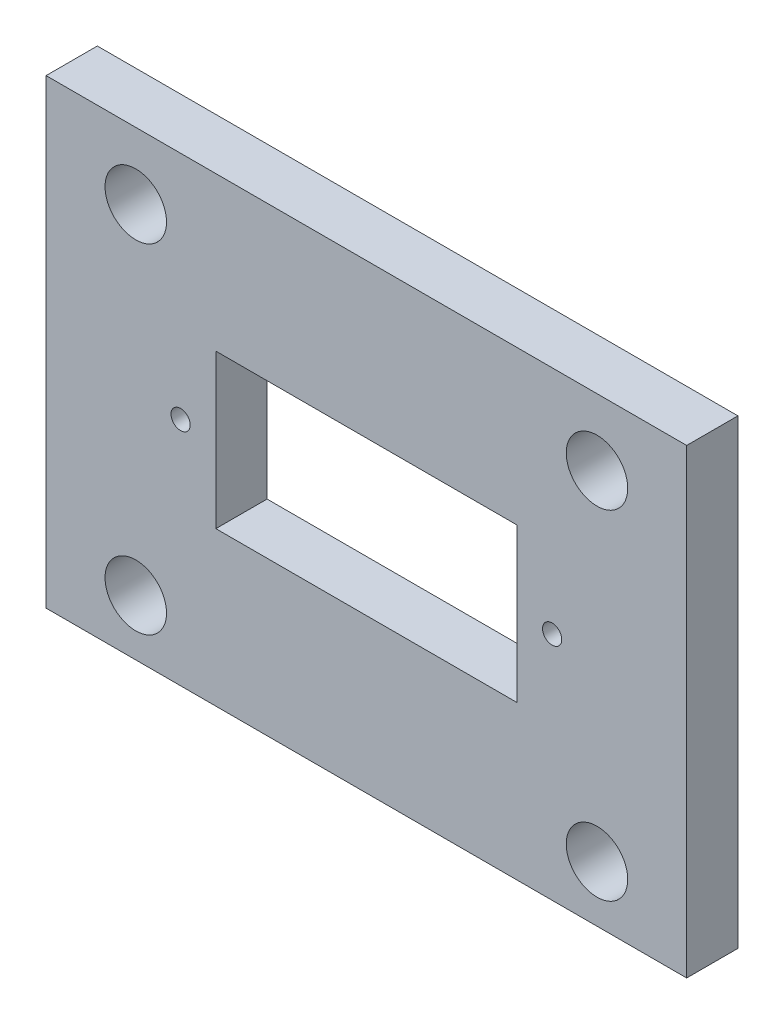
from build123d import *

# Parameters (mm, degrees)
SKETCH1_W           = 50
SKETCH1_H           = 36
SKETCH1_R           = 2.4
BOSS_EXTRUDE1_DEPTH = 4
CUT_EXTRUDE1_REACH  = 50.107
SKETCH2_R           = 0.75


with BuildPart() as part:
    # Sketch1 → Boss-Extrude1 (new body)
    with BuildSketch(Plane.XY):
        with Locations((-16.5, 6)):
            Rectangle(SKETCH1_W, SKETCH1_H)
        with Locations((-34.5, -7.636435185)):
            Circle(SKETCH1_R, mode=Mode.SUBTRACT)
        with Locations((1.5, -7.636435185)):
            Circle(SKETCH1_R, mode=Mode.SUBTRACT)
        Polygon((-28.25, 12), (-16.5, 12), (-4.75, 12), (-4.75, 0), (-16.5, 0), (-28.25, 0), align=None, mode=Mode.SUBTRACT)
        with Locations((-34.5, 18.79673301)):
            Circle(SKETCH1_R, mode=Mode.SUBTRACT)
        with Locations((1.5, 18.79673301)):
            Circle(SKETCH1_R, mode=Mode.SUBTRACT)
    extrude(amount=BOSS_EXTRUDE1_DEPTH)

    # Sketch2 → Cut-Extrude1 (cut, up to next)
    with BuildSketch(Plane.XY.offset(4), mode=Mode.PRIVATE) as cut_extrude1_sk1:
        with Locations((-31, 6)):
            Circle(SKETCH2_R)
    cut_extrude1_tool1 = extrude(cut_extrude1_sk1.sketch, amount=-CUT_EXTRUDE1_REACH, mode=Mode.PRIVATE) & part.part
    # Sketch2 → Cut-Extrude1 (cut, up to next)
    with BuildSketch(Plane.XY.offset(4), mode=Mode.PRIVATE) as cut_extrude1_sk2:
        with Locations((-2, 6)):
            Circle(SKETCH2_R)
    cut_extrude1_tool2 = extrude(cut_extrude1_sk2.sketch, amount=-CUT_EXTRUDE1_REACH, mode=Mode.PRIVATE) & part.part
    add(cut_extrude1_tool1.solids().sort_by_distance((-31, 6, 4))[0], mode=Mode.SUBTRACT)
    add(cut_extrude1_tool2.solids().sort_by_distance((-2, 6, 4))[0], mode=Mode.SUBTRACT)


solid = part.part
